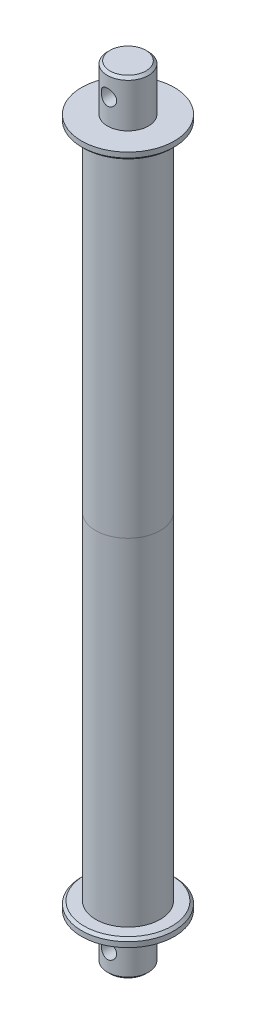
from build123d import *

# Parameters (mm, degrees)
SKETCH_1_R               = 7.95
EXTRUDE_1_DEPTH          = 18
CHAMFER_2_SIZE           = 1
CUT_EXTRUDE_2_DEPTH      = 22.22274723
CUT_EXTRUDE_2_DEPTH_BACK = 22.22274723
SKETCH_9_R               = 3
SKETCH_4_R               = 18
EXTRUDE_2_DEPTH          = 3
CHAMFER_1_SIZE           = 1
SKETCH_5_R               = 12.5
EXTRUDE_3_DEPTH          = 130.6


with BuildPart() as part:
    # 草图1 → 凸台-拉伸1 (new body)
    with BuildSketch(Plane(origin=(0, 0, 0), x_dir=(1, 0, 0), z_dir=(0, 1, 0))):
        Circle(SKETCH_1_R)
    extrude(amount=EXTRUDE_1_DEPTH)

    # 倒角2
    chamfer_2_edges = [part.edges().sort_by_distance(p)[0] for p in [
        (-7.95, 18, 0),
    ]]
    chamfer(chamfer_2_edges, length=CHAMFER_2_SIZE)

    # 草图9 → 切除-拉伸2 (cut, two sides: drawn at the far end of the back side and taken through both)
    with BuildSketch(Plane.XY.offset(-CUT_EXTRUDE_2_DEPTH_BACK)):
        with Locations((0, 9.7)):
            Circle(SKETCH_9_R)
    extrude(amount=CUT_EXTRUDE_2_DEPTH + CUT_EXTRUDE_2_DEPTH_BACK, mode=Mode.SUBTRACT)

    # 草图4 → 凸台-拉伸2 (add)
    with BuildSketch(Plane(origin=(0, 0, 0), x_dir=(1, 0, 0), z_dir=(0, 1, 0))):
        Circle(SKETCH_4_R)
    extrude(amount=-EXTRUDE_2_DEPTH)

    # 倒角1
    chamfer_1_edges = [part.edges().sort_by_distance(p)[0] for p in [
        (-18, -3, 0),
    ]]
    chamfer(chamfer_1_edges, length=CHAMFER_1_SIZE)

    # 草图5 → 凸台-拉伸3 (add)
    with BuildSketch(Plane(origin=(0, -3, 0), x_dir=(-1, 0, 0), z_dir=(0, -1, 0))):
        Circle(SKETCH_5_R)
    extrude(amount=EXTRUDE_3_DEPTH)


with BuildPart() as body_2:
    # 镜向3: mirrored copy
    add(part.part.mirror(Plane(origin=(0, -133.6, 0), x_dir=(0, 0, 1), z_dir=(0, -1, 0))))


solid = Compound([part.part, body_2.part])
